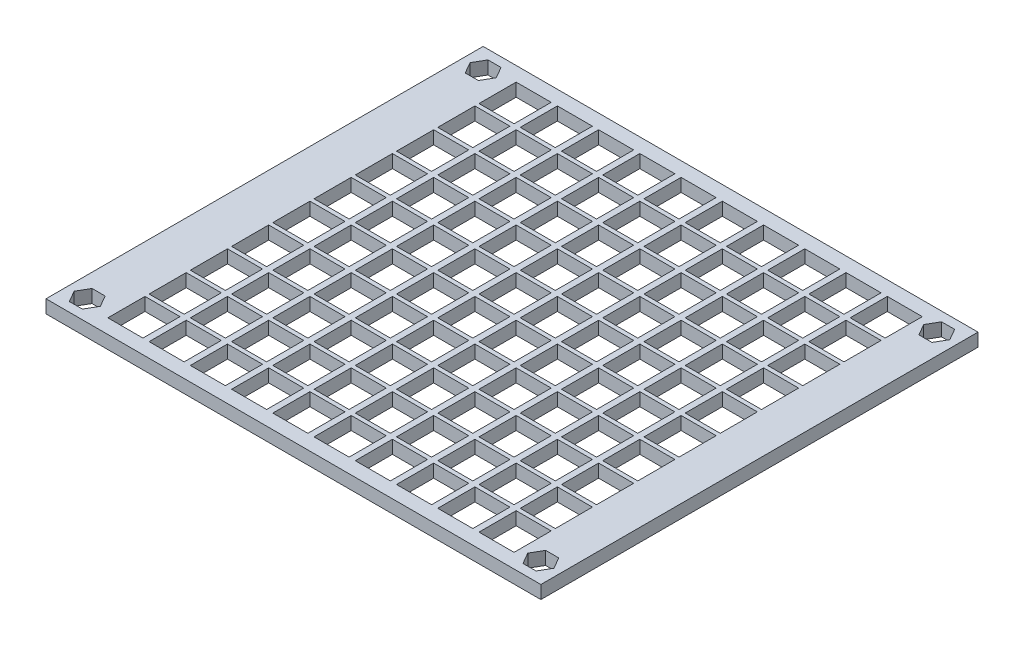
from build123d import *

# Parameters (mm, degrees)
SKETCH1_W           = 120
SKETCH1_H           = 106
SKETCH1_W_2         = 8.5
SKETCH1_H_2         = 9
BOSS_EXTRUDE1_DEPTH = 3.175


with BuildPart() as part:
    # Sketch1 → Boss-Extrude1 (new body)
    with BuildSketch(Plane(origin=(0, 0, 0), x_dir=(1, 0, 0), z_dir=(0, 1, 0))):
        with Locations((60, 53)):
            Rectangle(SKETCH1_W, SKETCH1_H)
        Polygon((3.41228676, 2.25), (1.824573519, 5), (3.41228676, 7.75), (6.58771324, 7.75), (8.175426481, 5), (6.58771324, 2.25), align=None, mode=Mode.SUBTRACT)
        with Locations((15.75, 8)):
            Rectangle(SKETCH1_W_2, SKETCH1_H_2, mode=Mode.SUBTRACT)
        with Locations((25.75, 8)):
            Rectangle(SKETCH1_W_2, SKETCH1_H_2, mode=Mode.SUBTRACT)
        with Locations((15.75, 18)):
            Rectangle(SKETCH1_W_2, SKETCH1_H_2, mode=Mode.SUBTRACT)
        with Locations((25.75, 18)):
            Rectangle(SKETCH1_W_2, SKETCH1_H_2, mode=Mode.SUBTRACT)
        with Locations((35.75, 8)):
            Rectangle(SKETCH1_W_2, SKETCH1_H_2, mode=Mode.SUBTRACT)
        with Locations((45.75, 8)):
            Rectangle(SKETCH1_W_2, SKETCH1_H_2, mode=Mode.SUBTRACT)
        with Locations((55.75, 8)):
            Rectangle(SKETCH1_W_2, SKETCH1_H_2, mode=Mode.SUBTRACT)
        with Locations((35.75, 18)):
            Rectangle(SKETCH1_W_2, SKETCH1_H_2, mode=Mode.SUBTRACT)
        with Locations((45.75, 18)):
            Rectangle(SKETCH1_W_2, SKETCH1_H_2, mode=Mode.SUBTRACT)
        with Locations((55.75, 18)):
            Rectangle(SKETCH1_W_2, SKETCH1_H_2, mode=Mode.SUBTRACT)
        with Locations((15.75, 28)):
            Rectangle(SKETCH1_W_2, SKETCH1_H_2, mode=Mode.SUBTRACT)
        with Locations((25.75, 28)):
            Rectangle(SKETCH1_W_2, SKETCH1_H_2, mode=Mode.SUBTRACT)
        with Locations((15.75, 38)):
            Rectangle(SKETCH1_W_2, SKETCH1_H_2, mode=Mode.SUBTRACT)
        with Locations((25.75, 38)):
            Rectangle(SKETCH1_W_2, SKETCH1_H_2, mode=Mode.SUBTRACT)
        with Locations((15.75, 48)):
            Rectangle(SKETCH1_W_2, SKETCH1_H_2, mode=Mode.SUBTRACT)
        with Locations((25.75, 48)):
            Rectangle(SKETCH1_W_2, SKETCH1_H_2, mode=Mode.SUBTRACT)
        with Locations((35.75, 28)):
            Rectangle(SKETCH1_W_2, SKETCH1_H_2, mode=Mode.SUBTRACT)
        with Locations((35.75, 38)):
            Rectangle(SKETCH1_W_2, SKETCH1_H_2, mode=Mode.SUBTRACT)
        with Locations((45.75, 28)):
            Rectangle(SKETCH1_W_2, SKETCH1_H_2, mode=Mode.SUBTRACT)
        with Locations((55.75, 28)):
            Rectangle(SKETCH1_W_2, SKETCH1_H_2, mode=Mode.SUBTRACT)
        with Locations((45.75, 38)):
            Rectangle(SKETCH1_W_2, SKETCH1_H_2, mode=Mode.SUBTRACT)
        with Locations((55.75, 38)):
            Rectangle(SKETCH1_W_2, SKETCH1_H_2, mode=Mode.SUBTRACT)
        with Locations((35.75, 48)):
            Rectangle(SKETCH1_W_2, SKETCH1_H_2, mode=Mode.SUBTRACT)
        with Locations((45.75, 48)):
            Rectangle(SKETCH1_W_2, SKETCH1_H_2, mode=Mode.SUBTRACT)
        with Locations((55.75, 48)):
            Rectangle(SKETCH1_W_2, SKETCH1_H_2, mode=Mode.SUBTRACT)
        with Locations((65.75, 8)):
            Rectangle(SKETCH1_W_2, SKETCH1_H_2, mode=Mode.SUBTRACT)
        with Locations((75.75, 8)):
            Rectangle(SKETCH1_W_2, SKETCH1_H_2, mode=Mode.SUBTRACT)
        with Locations((85.75, 8)):
            Rectangle(SKETCH1_W_2, SKETCH1_H_2, mode=Mode.SUBTRACT)
        with Locations((65.75, 18)):
            Rectangle(SKETCH1_W_2, SKETCH1_H_2, mode=Mode.SUBTRACT)
        with Locations((75.75, 18)):
            Rectangle(SKETCH1_W_2, SKETCH1_H_2, mode=Mode.SUBTRACT)
        with Locations((85.75, 18)):
            Rectangle(SKETCH1_W_2, SKETCH1_H_2, mode=Mode.SUBTRACT)
        with Locations((95.75, 8)):
            Rectangle(SKETCH1_W_2, SKETCH1_H_2, mode=Mode.SUBTRACT)
        Polygon((111.824573519, 5), (113.41228676, 7.75), (116.58771324, 7.75), (118.175426481, 5), (116.58771324, 2.25), (113.41228676, 2.25), align=None, mode=Mode.SUBTRACT)
        with Locations((105.75, 8)):
            Rectangle(SKETCH1_W_2, SKETCH1_H_2, mode=Mode.SUBTRACT)
        with Locations((95.75, 18)):
            Rectangle(SKETCH1_W_2, SKETCH1_H_2, mode=Mode.SUBTRACT)
        with Locations((105.75, 18)):
            Rectangle(SKETCH1_W_2, SKETCH1_H_2, mode=Mode.SUBTRACT)
        with Locations((65.75, 28)):
            Rectangle(SKETCH1_W_2, SKETCH1_H_2, mode=Mode.SUBTRACT)
        with Locations((65.75, 38)):
            Rectangle(SKETCH1_W_2, SKETCH1_H_2, mode=Mode.SUBTRACT)
        with Locations((75.75, 28)):
            Rectangle(SKETCH1_W_2, SKETCH1_H_2, mode=Mode.SUBTRACT)
        with Locations((85.75, 28)):
            Rectangle(SKETCH1_W_2, SKETCH1_H_2, mode=Mode.SUBTRACT)
        with Locations((75.75, 38)):
            Rectangle(SKETCH1_W_2, SKETCH1_H_2, mode=Mode.SUBTRACT)
        with Locations((85.75, 38)):
            Rectangle(SKETCH1_W_2, SKETCH1_H_2, mode=Mode.SUBTRACT)
        with Locations((65.75, 48)):
            Rectangle(SKETCH1_W_2, SKETCH1_H_2, mode=Mode.SUBTRACT)
        with Locations((75.75, 48)):
            Rectangle(SKETCH1_W_2, SKETCH1_H_2, mode=Mode.SUBTRACT)
        with Locations((85.75, 48)):
            Rectangle(SKETCH1_W_2, SKETCH1_H_2, mode=Mode.SUBTRACT)
        with Locations((95.75, 28)):
            Rectangle(SKETCH1_W_2, SKETCH1_H_2, mode=Mode.SUBTRACT)
        with Locations((95.75, 38)):
            Rectangle(SKETCH1_W_2, SKETCH1_H_2, mode=Mode.SUBTRACT)
        with Locations((105.75, 28)):
            Rectangle(SKETCH1_W_2, SKETCH1_H_2, mode=Mode.SUBTRACT)
        with Locations((105.75, 38)):
            Rectangle(SKETCH1_W_2, SKETCH1_H_2, mode=Mode.SUBTRACT)
        with Locations((95.75, 48)):
            Rectangle(SKETCH1_W_2, SKETCH1_H_2, mode=Mode.SUBTRACT)
        with Locations((105.75, 48)):
            Rectangle(SKETCH1_W_2, SKETCH1_H_2, mode=Mode.SUBTRACT)
        with Locations((15.75, 58)):
            Rectangle(SKETCH1_W_2, SKETCH1_H_2, mode=Mode.SUBTRACT)
        with Locations((25.75, 58)):
            Rectangle(SKETCH1_W_2, SKETCH1_H_2, mode=Mode.SUBTRACT)
        with Locations((15.75, 68)):
            Rectangle(SKETCH1_W_2, SKETCH1_H_2, mode=Mode.SUBTRACT)
        with Locations((25.75, 68)):
            Rectangle(SKETCH1_W_2, SKETCH1_H_2, mode=Mode.SUBTRACT)
        with Locations((15.75, 78)):
            Rectangle(SKETCH1_W_2, SKETCH1_H_2, mode=Mode.SUBTRACT)
        with Locations((25.75, 78)):
            Rectangle(SKETCH1_W_2, SKETCH1_H_2, mode=Mode.SUBTRACT)
        with Locations((35.75, 58)):
            Rectangle(SKETCH1_W_2, SKETCH1_H_2, mode=Mode.SUBTRACT)
        with Locations((45.75, 58)):
            Rectangle(SKETCH1_W_2, SKETCH1_H_2, mode=Mode.SUBTRACT)
        with Locations((55.75, 58)):
            Rectangle(SKETCH1_W_2, SKETCH1_H_2, mode=Mode.SUBTRACT)
        with Locations((35.75, 68)):
            Rectangle(SKETCH1_W_2, SKETCH1_H_2, mode=Mode.SUBTRACT)
        with Locations((35.75, 78)):
            Rectangle(SKETCH1_W_2, SKETCH1_H_2, mode=Mode.SUBTRACT)
        with Locations((45.75, 68)):
            Rectangle(SKETCH1_W_2, SKETCH1_H_2, mode=Mode.SUBTRACT)
        with Locations((55.75, 68)):
            Rectangle(SKETCH1_W_2, SKETCH1_H_2, mode=Mode.SUBTRACT)
        with Locations((45.75, 78)):
            Rectangle(SKETCH1_W_2, SKETCH1_H_2, mode=Mode.SUBTRACT)
        with Locations((55.75, 78)):
            Rectangle(SKETCH1_W_2, SKETCH1_H_2, mode=Mode.SUBTRACT)
        with Locations((15.75, 88)):
            Rectangle(SKETCH1_W_2, SKETCH1_H_2, mode=Mode.SUBTRACT)
        with Locations((25.75, 88)):
            Rectangle(SKETCH1_W_2, SKETCH1_H_2, mode=Mode.SUBTRACT)
        Polygon((8.175426481, 101), (6.58771324, 98.25), (3.41228676, 98.25), (1.824573519, 101), (3.41228676, 103.75), (6.58771324, 103.75), align=None, mode=Mode.SUBTRACT)
        with Locations((15.75, 98)):
            Rectangle(SKETCH1_W_2, SKETCH1_H_2, mode=Mode.SUBTRACT)
        with Locations((25.75, 98)):
            Rectangle(SKETCH1_W_2, SKETCH1_H_2, mode=Mode.SUBTRACT)
        with Locations((35.75, 88)):
            Rectangle(SKETCH1_W_2, SKETCH1_H_2, mode=Mode.SUBTRACT)
        with Locations((45.75, 88)):
            Rectangle(SKETCH1_W_2, SKETCH1_H_2, mode=Mode.SUBTRACT)
        with Locations((55.75, 88)):
            Rectangle(SKETCH1_W_2, SKETCH1_H_2, mode=Mode.SUBTRACT)
        with Locations((35.75, 98)):
            Rectangle(SKETCH1_W_2, SKETCH1_H_2, mode=Mode.SUBTRACT)
        with Locations((45.75, 98)):
            Rectangle(SKETCH1_W_2, SKETCH1_H_2, mode=Mode.SUBTRACT)
        with Locations((55.75, 98)):
            Rectangle(SKETCH1_W_2, SKETCH1_H_2, mode=Mode.SUBTRACT)
        with Locations((65.75, 58)):
            Rectangle(SKETCH1_W_2, SKETCH1_H_2, mode=Mode.SUBTRACT)
        with Locations((75.75, 58)):
            Rectangle(SKETCH1_W_2, SKETCH1_H_2, mode=Mode.SUBTRACT)
        with Locations((85.75, 58)):
            Rectangle(SKETCH1_W_2, SKETCH1_H_2, mode=Mode.SUBTRACT)
        with Locations((65.75, 68)):
            Rectangle(SKETCH1_W_2, SKETCH1_H_2, mode=Mode.SUBTRACT)
        with Locations((65.75, 78)):
            Rectangle(SKETCH1_W_2, SKETCH1_H_2, mode=Mode.SUBTRACT)
        with Locations((75.75, 68)):
            Rectangle(SKETCH1_W_2, SKETCH1_H_2, mode=Mode.SUBTRACT)
        with Locations((85.75, 68)):
            Rectangle(SKETCH1_W_2, SKETCH1_H_2, mode=Mode.SUBTRACT)
        with Locations((75.75, 78)):
            Rectangle(SKETCH1_W_2, SKETCH1_H_2, mode=Mode.SUBTRACT)
        with Locations((85.75, 78)):
            Rectangle(SKETCH1_W_2, SKETCH1_H_2, mode=Mode.SUBTRACT)
        with Locations((95.75, 58)):
            Rectangle(SKETCH1_W_2, SKETCH1_H_2, mode=Mode.SUBTRACT)
        with Locations((105.75, 58)):
            Rectangle(SKETCH1_W_2, SKETCH1_H_2, mode=Mode.SUBTRACT)
        with Locations((95.75, 68)):
            Rectangle(SKETCH1_W_2, SKETCH1_H_2, mode=Mode.SUBTRACT)
        with Locations((95.75, 78)):
            Rectangle(SKETCH1_W_2, SKETCH1_H_2, mode=Mode.SUBTRACT)
        with Locations((105.75, 68)):
            Rectangle(SKETCH1_W_2, SKETCH1_H_2, mode=Mode.SUBTRACT)
        with Locations((105.75, 78)):
            Rectangle(SKETCH1_W_2, SKETCH1_H_2, mode=Mode.SUBTRACT)
        with Locations((65.75, 88)):
            Rectangle(SKETCH1_W_2, SKETCH1_H_2, mode=Mode.SUBTRACT)
        with Locations((75.75, 88)):
            Rectangle(SKETCH1_W_2, SKETCH1_H_2, mode=Mode.SUBTRACT)
        with Locations((85.75, 88)):
            Rectangle(SKETCH1_W_2, SKETCH1_H_2, mode=Mode.SUBTRACT)
        with Locations((65.75, 98)):
            Rectangle(SKETCH1_W_2, SKETCH1_H_2, mode=Mode.SUBTRACT)
        with Locations((75.75, 98)):
            Rectangle(SKETCH1_W_2, SKETCH1_H_2, mode=Mode.SUBTRACT)
        with Locations((85.75, 98)):
            Rectangle(SKETCH1_W_2, SKETCH1_H_2, mode=Mode.SUBTRACT)
        with Locations((95.75, 88)):
            Rectangle(SKETCH1_W_2, SKETCH1_H_2, mode=Mode.SUBTRACT)
        with Locations((105.75, 88)):
            Rectangle(SKETCH1_W_2, SKETCH1_H_2, mode=Mode.SUBTRACT)
        with Locations((95.75, 98)):
            Rectangle(SKETCH1_W_2, SKETCH1_H_2, mode=Mode.SUBTRACT)
        with Locations((105.75, 98)):
            Rectangle(SKETCH1_W_2, SKETCH1_H_2, mode=Mode.SUBTRACT)
        Polygon((111.824573519, 101), (113.41228676, 103.75), (116.58771324, 103.75), (118.175426481, 101), (116.58771324, 98.25), (113.41228676, 98.25), align=None, mode=Mode.SUBTRACT)
    extrude(amount=BOSS_EXTRUDE1_DEPTH)


solid = part.part
